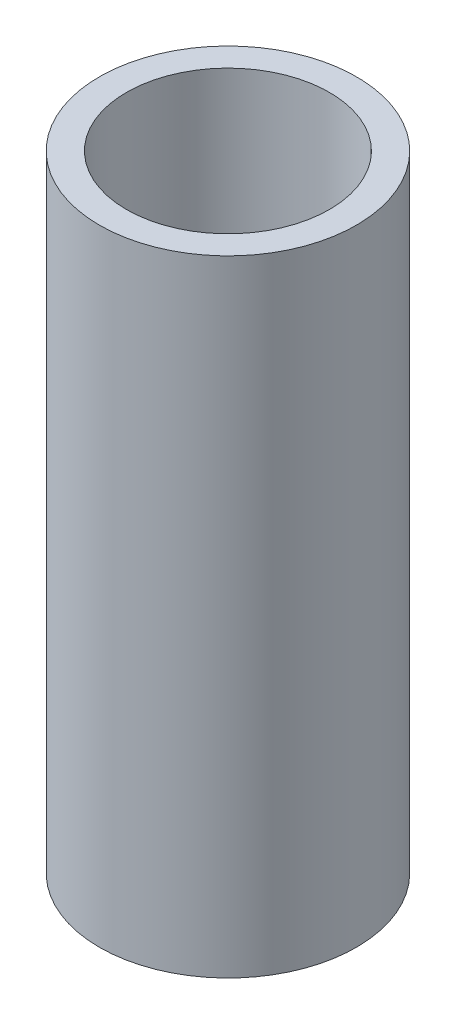
from build123d import *

# Parameters (mm, degrees)
SKETCH1_R           = 30
BOSS_EXTRUDE1_DEPTH = 145.965025001
SKETCH2_R           = 23.687631837
CUT_EXTRUDE1_DEPTH  = 153.005883187


with BuildPart() as part:
    # Sketch1 → Boss-Extrude1 (new body)
    with BuildSketch(Plane(origin=(0, 0, 0), x_dir=(1, 0, 0), z_dir=(0, 1, 0))):
        Circle(SKETCH1_R)
    extrude(amount=BOSS_EXTRUDE1_DEPTH)

    # Sketch2 → Cut-Extrude1 (cut, through all)
    with BuildSketch(Plane(origin=(0, 0, 0), x_dir=(1, 0, 0), z_dir=(0, 1, 0))):
        Circle(SKETCH2_R)
    extrude(amount=CUT_EXTRUDE1_DEPTH, mode=Mode.SUBTRACT)


solid = part.part
